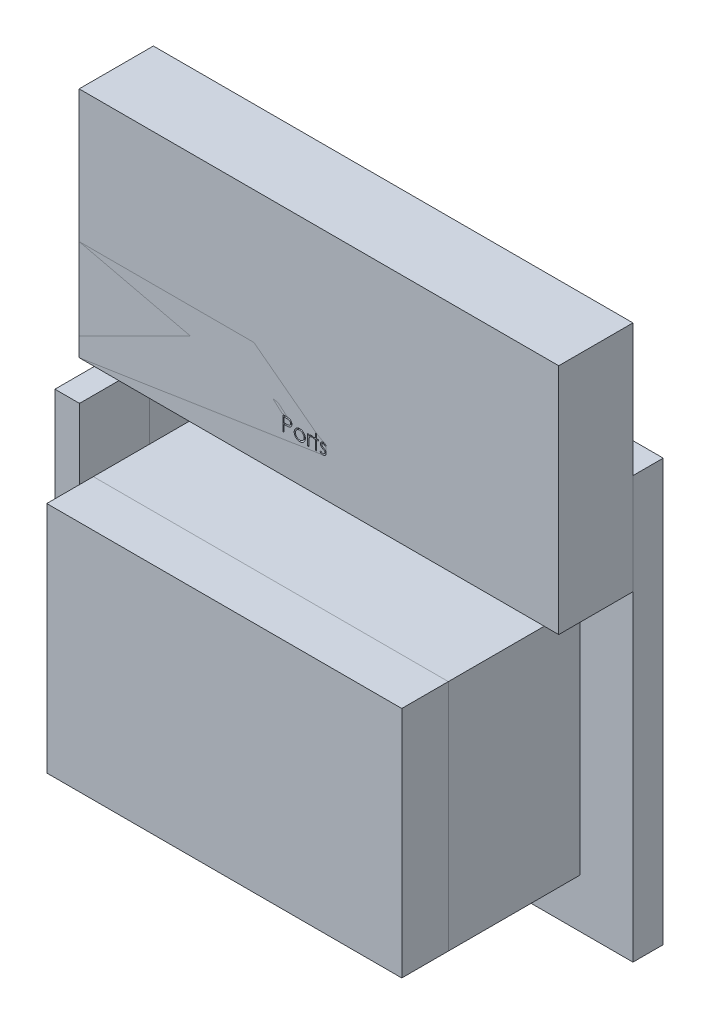
from build123d import *

# Parameters (mm, degrees)
SKETCH1_W           = 103
SKETCH1_H           = 90.5
BOSS_EXTRUDE1_DEPTH = 6.5
SKETCH2_W           = 76.24
SKETCH2_H           = 50.13
BOSS_EXTRUDE2_DEPTH = 28.27
SKETCH2_4_W         = 5.28
SKETCH2_4_H         = 51
BOSS_EXTRUDE3_DEPTH = 9
SKETCH2_5_W         = 103
SKETCH2_5_H         = 21.6
BOSS_EXTRUDE4_DEPTH = 15.94
SKETCH9_W           = 76.24
SKETCH9_H           = 50.13
BOSS_EXTRUDE5_DEPTH = 10
SKETCH10_W          = 103
SKETCH10_H          = 15.94
BOSS_EXTRUDE6_DEPTH = 50
CUT_EXTRUDE1_DEPTH  = 1
SKETCH8_W           = 0.284935898
SKETCH8_H           = 2.320192307
CUT_EXTRUDE2_DEPTH  = 1
SKETCH7_W           = 2.320192307
SKETCH7_H           = 0.284935897
CUT_EXTRUDE3_DEPTH  = 1
SKETCH11_W          = 5.28
SKETCH11_H          = 51
BOSS_EXTRUDE7_DEPTH = 15


with BuildPart() as part:
    # Sketch1 → Boss-Extrude1 (new body)
    with BuildSketch(Plane.XY):
        with Locations((51.5, 45.25)):
            Rectangle(SKETCH1_W, SKETCH1_H)
    extrude(amount=-BOSS_EXTRUDE1_DEPTH)

    # Sketch2 → Boss-Extrude2 (add)
    with BuildSketch(Plane.XY):
        with Locations((53.5, 35.565)):
            Rectangle(SKETCH2_W, SKETCH2_H)
    extrude(amount=BOSS_EXTRUDE2_DEPTH)

    # Sketch2<4> → Boss-Extrude3 (add)
    with BuildSketch(Plane.XY):
        with Locations((5.5, 43)):
            Rectangle(SKETCH2_4_W, SKETCH2_4_H)
    extrude(amount=BOSS_EXTRUDE3_DEPTH)

    # Sketch2<5> → Boss-Extrude4 (add)
    with BuildSketch(Plane.XY):
        with Locations((51.5, 79.7)):
            Rectangle(SKETCH2_5_W, SKETCH2_5_H)
    extrude(amount=BOSS_EXTRUDE4_DEPTH)


with BuildPart() as body_2:
    # Sketch9 → Boss-Extrude5 (new body)
    with BuildSketch(Plane.XY.offset(28.27)):
        with Locations((53.5, 35.565)):
            Rectangle(SKETCH9_W, SKETCH9_H)
    extrude(amount=BOSS_EXTRUDE5_DEPTH)


with BuildPart() as body_3:
    # Sketch10 → Boss-Extrude6 (new body)
    with BuildSketch(Plane.XZ.offset(-68.9)):
        with Locations((51.5, 7.97)):
            Rectangle(SKETCH10_W, SKETCH10_H)
    extrude(amount=-BOSS_EXTRUDE6_DEPTH)


with BuildPart() as cut_extrude1_tool:
    # Sketch6 → Cut-Extrude1 (new body)
    # profile 1 of 5: a face of its own
    with BuildSketch(Plane.XY.offset(15.94)):
        with BuildLine():
            Line((43.74356414, 80.197996717), (44.366225398, 80.197996717))
            add(Edge.make_bspline(
                [(44.366225398, 80.197996717), (44.409052435, 80.197949639), (44.491110938, 80.197859437), (44.608781024, 80.195124632), (44.715651281, 80.191471847), (44.811491269, 80.186408273), (44.896595873, 80.180424223), (44.970579994, 80.172031301), (45.034025163, 80.163268033), (45.0720403, 80.154358615), (45.089377442, 80.150295395)],
                knots=[0, 0, 0, 0, 1.415646017, 2.712440637, 3.8905458, 4.950247383, 5.884950622, 6.709939814, 7.411656543, 8, 8, 8, 8], degree=3))
            add(Edge.make_bspline(
                [(45.089377442, 80.150295395), (45.111324433, 80.14428834), (45.154701262, 80.13241578), (45.217204351, 80.108636188), (45.276671054, 80.080440224), (45.333305396, 80.04830565), (45.386411429, 80.010853745), (45.43678148, 79.969602678), (45.483971034, 79.92360004), (45.527714725, 79.873361798), (45.567887363, 79.819731322), (45.602476432, 79.761908013), (45.631438988, 79.700865188), (45.656279527, 79.636645305), (45.674157911, 79.568709083), (45.68762617, 79.497528566), (45.696174747, 79.423111383), (45.696993499, 79.372257074), (45.697410294, 79.346369113)],
                knots=[0, 0, 0, 0, 0.999701418, 1.975846123, 2.934577507, 3.890451536, 4.834027766, 5.787354733, 6.749476667, 7.726910423, 8.712836071, 9.690891519, 10.682875813, 11.679750201, 12.712814741, 13.765529915, 14.8625177, 16, 16, 16, 16], degree=3))
            add(Edge.make_bspline(
                [(45.697410294, 79.346369113), (45.697028002, 79.320263558), (45.696280021, 79.269186277), (45.687302676, 79.194462391), (45.675210288, 79.123053565), (45.656616534, 79.055118135), (45.632263673, 78.991059543), (45.603695882, 78.929898854), (45.569239394, 78.872676581), (45.529647298, 78.819184981), (45.485604066, 78.769373846), (45.437296044, 78.72360414), (45.384918257, 78.682143776), (45.328637166, 78.644899807), (45.267904089, 78.612735896), (45.203640135, 78.583927484), (45.135286724, 78.559733022), (45.087986015, 78.547005752), (45.063936737, 78.540534778)],
                knots=[0, 0, 0, 0, 1.121902311, 2.195077645, 3.232258892, 4.234102512, 5.217864754, 6.176164875, 7.132989551, 8.084763148, 9.034132444, 9.988522005, 10.94243251, 11.903244335, 12.886203696, 13.894208494, 14.929344452, 16, 16, 16, 16], degree=3))
            add(Edge.make_bspline(
                [(45.063936737, 78.540534778), (45.044045512, 78.536304788), (45.000452737, 78.527034519), (44.928658982, 78.516685419), (44.845069954, 78.507852024), (44.749799742, 78.501228849), (44.642933864, 78.495558872), (44.52441451, 78.491052101), (44.394009025, 78.488575733), (44.303048682, 78.488448014), (44.255558331, 78.488381332)],
                knots=[0, 0, 0, 0, 0.601384939, 1.31797006, 2.144135048, 3.087295005, 4.142315834, 5.309527816, 6.595305764, 8, 8, 8, 8], degree=3))
            Line((44.255558331, 78.488381332), (44.028500038, 78.488381332))
            Line((44.028500038, 78.488381332), (44.028500038, 77.022996717))
            Line((44.028500038, 77.022996717), (43.74356414, 77.022996717))
            Line((43.74356414, 77.022996717), (43.74356414, 80.197996717))
        make_face()
        with BuildLine():
            Line((44.028500038, 79.872355691), (44.028500038, 78.814022358))
            Line((44.028500038, 78.814022358), (44.584379445, 78.807026164))
            add(Edge.make_bspline(
                [(44.584379445, 78.807026164), (44.611521092, 78.807012136), (44.663917482, 78.806985056), (44.739606056, 78.810600223), (44.809827338, 78.814773563), (44.874365631, 78.820884008), (44.933250029, 78.829521149), (44.986578716, 78.838240368), (45.03393818, 78.850854519), (45.089363884, 78.867839017), (45.151125206, 78.896806461), (45.218315054, 78.938852433), (45.275256943, 78.992447075), (45.324531398, 79.052706608), (45.363634587, 79.119743676), (45.39226038, 79.191470497), (45.409079859, 79.267151475), (45.411335192, 79.318938572), (45.412474397, 79.345097077)],
                knots=[0, 0, 0, 0, 1.160613943, 2.240541288, 3.23993089, 4.169200891, 5.011653406, 5.7853311, 6.478053781, 7.106038997, 8.262395093, 9.384106736, 10.481365981, 11.59014053, 12.70357646, 13.786202915, 14.881775077, 16, 16, 16, 16], degree=3))
            add(Edge.make_bspline(
                [(45.412474397, 79.345097077), (45.411328996, 79.370622729), (45.409052081, 79.421364565), (45.392128548, 79.495731012), (45.363690242, 79.566701972), (45.324268903, 79.632898985), (45.276425163, 79.692941686), (45.220817902, 79.745099794), (45.157578015, 79.787029482), (45.098751405, 79.81409253), (45.046498901, 79.830616387), (45.001112766, 79.842177778), (44.949867654, 79.851408507), (44.892746883, 79.858882913), (44.830193183, 79.86528141), (44.761669141, 79.869622975), (44.687434336, 79.872164296), (44.635899032, 79.872290348), (44.609184132, 79.872355691)],
                knots=[0, 0, 0, 0, 1.120700087, 2.227813068, 3.331159281, 4.466773991, 5.599788987, 6.693661531, 7.80175334, 8.91857717, 9.525282508, 10.207424825, 10.974604443, 11.810962634, 12.737642355, 13.736264703, 14.826523623, 16, 16, 16, 16], degree=3))
            Line((44.609184132, 79.872355691), (44.028500038, 79.872355691))
        make_face(mode=Mode.SUBTRACT)
    # profile 2 of 5: a face of its own
    with BuildSketch(Plane.XY.offset(15.94)):
        with BuildLine():
            add(Edge.make_bspline(
                [(47.38794515, 79.383894153), (47.43148009, 79.382967151), (47.516841469, 79.381149528), (47.641852908, 79.361723095), (47.761183139, 79.332016558), (47.875289185, 79.290948783), (47.982709681, 79.235901585), (48.08500931, 79.170216014), (48.181907596, 79.092398947), (48.23998563, 79.032202699), (48.269465583, 79.001647558)],
                knots=[0, 0, 0, 0, 1.054011418, 2.066658804, 3.057071809, 4.030435133, 4.997543892, 5.974964718, 6.972108034, 8, 8, 8, 8], degree=3))
            add(Edge.make_bspline(
                [(48.269465583, 79.001647558), (48.294849212, 78.972424871), (48.345125229, 78.914545036), (48.409591988, 78.820696016), (48.465128689, 78.723504639), (48.509635804, 78.621680278), (48.544728647, 78.516111827), (48.569643957, 78.406436431), (48.584463891, 78.292896302), (48.586462296, 78.215785677), (48.587474397, 78.176732694)],
                knots=[0, 0, 0, 0, 1.025258237, 2.030674902, 3.01204498, 3.988269485, 4.97094183, 5.956517959, 6.965070386, 8, 8, 8, 8], degree=3))
            add(Edge.make_bspline(
                [(48.587474397, 78.176732694), (48.586584184, 78.137453356), (48.584825081, 78.059835552), (48.5681848, 77.945517985), (48.54230303, 77.834669824), (48.505262719, 77.727755152), (48.457766434, 77.624447159), (48.399808454, 77.525197068), (48.330982058, 77.429809061), (48.252964147, 77.339093108), (48.166738516, 77.255485184), (48.073197439, 77.182615968), (47.974179137, 77.120185014), (47.868366952, 77.069896266), (47.75672716, 77.030245323), (47.639018963, 77.002396023), (47.515425221, 76.985557924), (47.431036241, 76.983395682), (47.38794515, 76.982291589)],
                knots=[0, 0, 0, 0, 0.998656419, 1.973391657, 2.932242238, 3.890759089, 4.846373663, 5.82037756, 6.809684879, 7.83454468, 8.860553229, 9.859544525, 10.845671541, 11.83227036, 12.833544569, 13.85385346, 14.904124723, 16, 16, 16, 16], degree=3))
            add(Edge.make_bspline(
                [(47.38794515, 76.982291589), (47.34464294, 76.983399388), (47.259833375, 76.985569069), (47.135803377, 77.002330604), (47.017884222, 77.030232488), (46.906098279, 77.070026571), (46.799831168, 77.120186621), (46.700239132, 77.182427226), (46.606622066, 77.255506795), (46.520378194, 77.339087252), (46.442365173, 77.42981057), (46.373537516, 77.525196676), (46.315579863, 77.624447261), (46.268083492, 77.727755125), (46.231043205, 77.834669832), (46.205161428, 77.945517983), (46.188521149, 78.059835553), (46.186762046, 78.137453356), (46.185871833, 78.176732694)],
                knots=[0, 0, 0, 0, 1.099876186, 2.154163076, 3.173186993, 4.173200201, 5.163417411, 6.152872554, 7.150605724, 8.17532212, 9.198891216, 10.186952605, 11.159729845, 12.11414092, 13.071450619, 14.029093627, 15.002601286, 16, 16, 16, 16], degree=3))
            add(Edge.make_bspline(
                [(46.185871833, 78.176732694), (46.186890836, 78.215573418), (46.188908286, 78.292471376), (46.20371332, 78.405798067), (46.228531439, 78.515287841), (46.263666348, 78.620448809), (46.3085837, 78.721826954), (46.363340011, 78.819258479), (46.428464371, 78.912683127), (46.478540427, 78.970488157), (46.503880647, 78.999739505)],
                knots=[0, 0, 0, 0, 1.031353054, 2.041901799, 3.029428768, 4.008703097, 4.981709435, 5.96992636, 6.972712378, 8, 8, 8, 8], degree=3))
            add(Edge.make_bspline(
                [(46.503880647, 78.999739505), (46.533316154, 79.030559629), (46.591206259, 79.091172824), (46.688586891, 79.168763043), (46.790634857, 79.235815481), (46.899242469, 79.289768905), (47.013254776, 79.332258132), (47.133196517, 79.361799706), (47.258632163, 79.381079536), (47.344411248, 79.382946597), (47.38794515, 79.383894153)],
                knots=[0, 0, 0, 0, 1.027980169, 2.021703884, 2.998553061, 3.971491411, 4.943284454, 5.930300938, 6.949603206, 8, 8, 8, 8], degree=3))
        make_face()
        with BuildLine():
            add(Edge.make_bspline(
                [(47.386673115, 79.098958255), (47.355886853, 79.098083233), (47.295109072, 79.096355776), (47.20564702, 79.083216806), (47.119522738, 79.062400141), (47.036572829, 79.032823605), (46.957077023, 78.994633889), (46.880959208, 78.947727019), (46.807995494, 78.892724266), (46.739613194, 78.8297117), (46.676854954, 78.760878612), (46.621992789, 78.687537601), (46.575342871, 78.610878272), (46.536480727, 78.530820909), (46.507536349, 78.446554219), (46.486515108, 78.359032504), (46.473388532, 78.268077448), (46.471677317, 78.206245667), (46.47080773, 78.174824641)],
                knots=[0, 0, 0, 0, 1.021534396, 2.016698045, 2.994645724, 3.958388632, 4.93408049, 5.916473867, 6.921342795, 7.962252576, 8.998418191, 10.008913653, 10.997312074, 11.973003931, 12.956656626, 13.948281152, 14.957379055, 16, 16, 16, 16], degree=3))
            add(Edge.make_bspline(
                [(46.47080773, 78.174824641), (46.472265349, 78.13422816), (46.475158449, 78.053651735), (46.498685414, 77.934987359), (46.538042967, 77.821066679), (46.59119, 77.712557529), (46.657779927, 77.612161962), (46.736236051, 77.52265283), (46.825716351, 77.44537713), (46.925154176, 77.381259505), (47.03251845, 77.330314584), (47.146143827, 77.294211228), (47.2646536, 77.270741907), (47.345643977, 77.268409212), (47.386673115, 77.267227486)],
                knots=[0, 0, 0, 0, 1.016792936, 2.018143844, 3.017858371, 4.030088057, 5.03801393, 6.028138512, 7.003788237, 7.991172063, 8.984598303, 9.972568034, 10.972917682, 12, 12, 12, 12], degree=3))
            add(Edge.make_bspline(
                [(47.386673115, 77.267227486), (47.427699892, 77.268416097), (47.508685612, 77.270762383), (47.627030722, 77.294093027), (47.740345539, 77.330472776), (47.847598298, 77.381202209), (47.94699086, 77.445620614), (48.037114705, 77.522216471), (48.114900946, 77.612399036), (48.181425001, 77.712690508), (48.235442404, 77.820898456), (48.274615737, 77.935008385), (48.298199261, 78.05364638), (48.301084727, 78.134226366), (48.302538499, 78.174824641)],
                knots=[0, 0, 0, 0, 1.02726834, 2.027799167, 3.010890988, 4.004497153, 4.992059811, 5.971914811, 6.958719428, 7.966827853, 8.981595046, 9.981490638, 10.983022906, 12, 12, 12, 12], degree=3))
            add(Edge.make_bspline(
                [(48.302538499, 78.174824641), (48.301669212, 78.206245854), (48.299958586, 78.268078005), (48.286827725, 78.359030373), (48.265822343, 78.446562036), (48.236819519, 78.530792068), (48.198126235, 78.611085554), (48.150576715, 78.68731252), (48.095938571, 78.761132673), (48.03242304, 78.82948919), (47.964112118, 78.89274883), (47.891118834, 78.947748348), (47.815113889, 78.994427738), (47.735849032, 79.033150256), (47.652888488, 79.062131058), (47.566884878, 79.083337002), (47.477804529, 79.096300252), (47.41724454, 79.098066587), (47.386673115, 79.098958255)],
                knots=[0, 0, 0, 0, 1.042956736, 2.052379634, 3.044323526, 4.02829302, 5.004299113, 5.996692471, 7.007513377, 8.048758398, 9.090003419, 10.095195979, 11.07790575, 12.047570684, 13.018257071, 13.989683339, 14.985167495, 16, 16, 16, 16], degree=3))
        make_face(mode=Mode.SUBTRACT)
    # profile 3 of 5: a face of its own
    with BuildSketch(Plane.XY.offset(15.94)):
        with BuildLine():
            Line((49.075935935, 79.343189024), (49.360871833, 79.343189024))
            Line((49.360871833, 79.343189024), (49.360871833, 79.001647558))
            add(Edge.make_bspline(
                [(49.360871833, 79.001647558), (49.38190735, 79.033448202), (49.422137612, 79.094266687), (49.48900577, 79.17470241), (49.557498077, 79.241300346), (49.627942426, 79.294371395), (49.700856845, 79.334116153), (49.77464108, 79.36322912), (49.85045597, 79.380444256), (49.901402859, 79.382742647), (49.926927522, 79.383894153)],
                knots=[0, 0, 0, 0, 1.2804753, 2.448899062, 3.506932113, 4.484331642, 5.4025378, 6.288909075, 7.142734305, 8, 8, 8, 8], degree=3))
            add(Edge.make_bspline(
                [(49.926927522, 79.383894153), (49.946727118, 79.382814175), (49.987466074, 79.380592051), (50.049135995, 79.364979374), (50.112675412, 79.340052882), (50.153626006, 79.316612109), (50.174974397, 79.304391949)],
                knots=[0, 0, 0, 0, 0.901110191, 1.854092781, 2.881294221, 4, 4, 4, 4], degree=3))
            Line((50.174974397, 79.304391949), (50.01851406, 79.057617109))
            add(Edge.make_bspline(
                [(50.01851406, 79.057617109), (50.00480802, 79.063731494), (49.978791331, 79.075337765), (49.940732546, 79.089073732), (49.905643047, 79.097161741), (49.883287819, 79.098387035), (49.872866023, 79.098958255)],
                knots=[0, 0, 0, 0, 1.180555205, 2.24091978, 3.179933427, 4, 4, 4, 4], degree=3))
            add(Edge.make_bspline(
                [(49.872866023, 79.098958255), (49.850000822, 79.097434221), (49.80336244, 79.094325634), (49.734887216, 79.069888287), (49.668441536, 79.030404676), (49.615671528, 78.986615882), (49.57481177, 78.94439038), (49.545655994, 78.907516472), (49.518910931, 78.866170142), (49.493356517, 78.821058214), (49.470073521, 78.771410425), (49.448343214, 78.717722796), (49.428695531, 78.659933144), (49.417492096, 78.619671857), (49.411753243, 78.599048399)],
                knots=[0, 0, 0, 0, 1.125678352, 2.296057538, 3.5422874, 4.923748041, 5.663163013, 6.437101912, 7.23742474, 8.08941207, 8.991984279, 9.93940061, 10.944477711, 12, 12, 12, 12], degree=3))
            add(Edge.make_bspline(
                [(49.411753243, 78.599048399), (49.407460286, 78.580654106), (49.397951713, 78.539912145), (49.388706532, 78.471560269), (49.379572041, 78.390803092), (49.373134394, 78.297415826), (49.36716717, 78.19163168), (49.363801596, 78.073289501), (49.360986604, 77.942267818), (49.36091125, 77.850669655), (49.360871833, 77.802754329)],
                knots=[0, 0, 0, 0, 0.566838948, 1.255505196, 2.06880316, 3.007127437, 4.065329342, 5.249902469, 6.561414163, 8, 8, 8, 8], degree=3))
            Line((49.360871833, 77.802754329), (49.360871833, 77.022996717))
            Line((49.360871833, 77.022996717), (49.075935935, 77.022996717))
            Line((49.075935935, 77.022996717), (49.075935935, 79.343189024))
        make_face()
    # profile 4 of 5: a face of its own
    with BuildSketch(Plane.XY.offset(15.94)):
        Polygon((50.744846192, 80.279406973), (51.029782089, 80.279406973), (51.029782089, 79.343189024), (51.436833371, 79.343189024), (51.436833371, 79.058253127), (51.029782089, 79.058253127), (51.029782089, 77.022996717), (50.744846192, 77.022996717), (50.744846192, 79.058253127), (50.33779491, 79.058253127), (50.33779491, 79.343189024), (50.744846192, 79.343189024), align=None)
    # profile 5 of 5: a face of its own
    with BuildSketch(Plane.XY.offset(15.94)):
        with BuildLine():
            Line((53.024333371, 79.053801004), (52.830984012, 78.854727486))
            add(Edge.make_bspline(
                [(52.830984012, 78.854727486), (52.814301198, 78.874061554), (52.782138697, 78.911335362), (52.731128711, 78.96117113), (52.680307299, 79.003023924), (52.630370161, 79.038359188), (52.580061588, 79.065073771), (52.529971955, 79.084572681), (52.4800494, 79.096639319), (52.446679211, 79.09819456), (52.430292906, 79.098958255)],
                knots=[0, 0, 0, 0, 1.26578478, 2.440284043, 3.530471711, 4.527705817, 5.468200915, 6.346673037, 7.188140097, 8, 8, 8, 8], degree=3))
            add(Edge.make_bspline(
                [(52.430292906, 79.098958255), (52.410209317, 79.097983192), (52.370687656, 79.096064405), (52.31405852, 79.076911508), (52.261489025, 79.047512152), (52.215989479, 79.00581208), (52.177447083, 78.95794735), (52.149313244, 78.904429256), (52.132108387, 78.846872816), (52.129926952, 78.806931445), (52.128820551, 78.7866736)],
                knots=[0, 0, 0, 0, 0.99966794, 1.967205029, 2.953328237, 3.988086729, 5.028030931, 6.008226631, 6.989793394, 8, 8, 8, 8], degree=3))
            add(Edge.make_bspline(
                [(52.128820551, 78.7866736), (52.129828216, 78.768338388), (52.131840706, 78.731719652), (52.147485908, 78.677701078), (52.172401559, 78.625035051), (52.195688093, 78.592774414), (52.207686737, 78.576151765)],
                knots=[0, 0, 0, 0, 0.960159726, 1.917612774, 2.927026955, 4, 4, 4, 4], degree=3))
            add(Edge.make_bspline(
                [(52.207686737, 78.576151765), (52.214910763, 78.567275749), (52.230286193, 78.548384268), (52.25914106, 78.522164344), (52.291818616, 78.493188159), (52.331115988, 78.464216886), (52.375340135, 78.433708106), (52.425450057, 78.402863314), (52.479855501, 78.3693313), (52.518805772, 78.348063848), (52.539051921, 78.337009137)],
                knots=[0, 0, 0, 0, 0.66740084, 1.420478572, 2.27185888, 3.217733974, 4.268547843, 5.408967954, 6.65319498, 8, 8, 8, 8], degree=3))
            add(Edge.make_bspline(
                [(52.539051921, 78.337009137), (52.563738523, 78.323179832), (52.611424909, 78.296466169), (52.67918192, 78.255000938), (52.74067445, 78.213788146), (52.79642352, 78.173268547), (52.845356446, 78.132308446), (52.888957862, 78.092477838), (52.926140236, 78.052573251), (52.946962727, 78.024693927), (52.956915503, 78.011368111)],
                knots=[0, 0, 0, 0, 1.27191281, 2.456916733, 3.569705269, 4.599008579, 5.553216877, 6.436649441, 7.252746552, 8, 8, 8, 8], degree=3))
            add(Edge.make_bspline(
                [(52.956915503, 78.011368111), (52.973435052, 77.984456731), (53.006312023, 77.93089809), (53.040836307, 77.842707088), (53.060848128, 77.749171133), (53.063625999, 77.685188333), (53.065038499, 77.652654169)],
                knots=[0, 0, 0, 0, 0.995354457, 1.980940102, 2.973342416, 4, 4, 4, 4], degree=3))
            add(Edge.make_bspline(
                [(53.065038499, 77.652654169), (53.064385779, 77.629731443), (53.063099523, 77.584559708), (53.054156848, 77.518034541), (53.038776263, 77.454412479), (53.017826929, 77.393003185), (52.989538248, 77.334983289), (52.956384175, 77.278888978), (52.916583362, 77.225933669), (52.871143328, 77.176186898), (52.82139063, 77.13075197), (52.768317205, 77.090815955), (52.711857694, 77.057637806), (52.652415524, 77.030182814), (52.589855638, 77.008349466), (52.524168254, 76.99323417), (52.45556217, 76.984187451), (52.408907986, 76.982931533), (52.385135655, 76.982291589)],
                knots=[0, 0, 0, 0, 1.032770009, 2.035186124, 3.017557409, 3.978232242, 4.952395191, 5.920591857, 6.910227898, 7.931268572, 8.952309245, 9.941945286, 10.918353717, 11.897095711, 12.887975737, 13.898235213, 14.929059601, 16, 16, 16, 16], degree=3))
            add(Edge.make_bspline(
                [(52.385135655, 76.982291589), (52.353052574, 76.98319211), (52.289332205, 76.984980639), (52.195089388, 77.00176828), (52.102995557, 77.027889816), (52.013747631, 77.063917842), (51.929341514, 77.109411703), (51.852115603, 77.163896874), (51.781801634, 77.225573515), (51.741780057, 77.272847369), (51.721769269, 77.296484297)],
                knots=[0, 0, 0, 0, 1.013940152, 2.01379169, 3.017749504, 4.037548394, 5.051665909, 6.043208538, 7.021604269, 8, 8, 8, 8], degree=3))
            Line((51.721769269, 77.296484297), (51.910666504, 77.511458255))
            add(Edge.make_bspline(
                [(51.910666504, 77.511458255), (51.928602907, 77.492086433), (51.963375337, 77.454531227), (52.018984298, 77.404525575), (52.075571326, 77.362614422), (52.132571363, 77.327559324), (52.190828163, 77.30054878), (52.250015256, 77.281572627), (52.310012255, 77.269376824), (52.350309478, 77.267945096), (52.370507249, 77.267227486)],
                knots=[0, 0, 0, 0, 1.179806542, 2.287233372, 3.337373186, 4.324005949, 5.273901747, 6.200048787, 7.097828587, 8, 8, 8, 8], degree=3))
            add(Edge.make_bspline(
                [(52.370507249, 77.267227486), (52.398009939, 77.26847102), (52.451745582, 77.270900677), (52.528710992, 77.292959753), (52.599775317, 77.327549067), (52.661482209, 77.376611614), (52.714007741, 77.433721312), (52.752042585, 77.498050549), (52.77587883, 77.56771137), (52.778678271, 77.616000673), (52.780102602, 77.640569834)],
                knots=[0, 0, 0, 0, 1.072336372, 2.095165389, 3.102688358, 4.141489647, 5.156069229, 6.117746104, 7.042326257, 8, 8, 8, 8], degree=3))
            add(Edge.make_bspline(
                [(52.780102602, 77.640569834), (52.779117178, 77.660807845), (52.77717159, 77.700765089), (52.761892336, 77.758595755), (52.737750677, 77.813450032), (52.713979317, 77.845553497), (52.701872434, 77.861903968)],
                knots=[0, 0, 0, 0, 1.013901739, 2.00181326, 2.98231254, 4, 4, 4, 4], degree=3))
            add(Edge.make_bspline(
                [(52.701872434, 77.861903968), (52.694594976, 77.870100333), (52.678742044, 77.887954974), (52.649663361, 77.913740581), (52.614845529, 77.941533714), (52.573896953, 77.970863084), (52.526735084, 78.001341819), (52.473168774, 78.032810017), (52.413931844, 78.066762311), (52.372048486, 78.089277284), (52.350154685, 78.101046597)],
                knots=[0, 0, 0, 0, 0.615000592, 1.339693406, 2.178160186, 3.116406724, 4.166410947, 5.330106347, 6.604359322, 8, 8, 8, 8], degree=3))
            add(Edge.make_bspline(
                [(52.350154685, 78.101046597), (52.326526662, 78.114235666), (52.280704384, 78.139813481), (52.21580077, 78.179651639), (52.157247098, 78.220171238), (52.103634434, 78.259099314), (52.056316951, 78.298488313), (52.015481055, 78.338381963), (51.979518995, 78.377171379), (51.959609557, 78.404655355), (51.950099597, 78.417783375)],
                knots=[0, 0, 0, 0, 1.262093308, 2.447601706, 3.550203992, 4.582594899, 5.537233252, 6.418365656, 7.244515135, 8, 8, 8, 8], degree=3))
            add(Edge.make_bspline(
                [(51.950099597, 78.417783375), (51.933652553, 78.444222612), (51.900752718, 78.497110324), (51.868807509, 78.585384828), (51.846849182, 78.67831713), (51.844887586, 78.742440205), (51.843884653, 78.775225282)],
                knots=[0, 0, 0, 0, 0.985009483, 1.970363186, 2.962279964, 4, 4, 4, 4], degree=3))
            add(Edge.make_bspline(
                [(51.843884653, 78.775225282), (51.844369245, 78.796656893), (51.845317659, 78.838601593), (51.852886906, 78.900231808), (51.866667958, 78.958786205), (51.883953495, 79.015144145), (51.907977363, 79.068213902), (51.93668472, 79.118703179), (51.970419027, 79.16654219), (52.009284012, 79.210995031), (52.052016469, 79.251371349), (52.098185296, 79.286567247), (52.146752143, 79.31659944), (52.197922638, 79.341786407), (52.252188352, 79.360837662), (52.309169974, 79.373952575), (52.368752165, 79.382711224), (52.409483901, 79.383494164), (52.430292906, 79.383894153)],
                knots=[0, 0, 0, 0, 1.087655834, 2.128696564, 3.144119009, 4.137814668, 5.115653402, 6.093965665, 7.082169637, 8.081268856, 9.086088321, 10.061021666, 11.022561449, 11.980240094, 12.950172527, 13.934149372, 14.944599409, 16, 16, 16, 16], degree=3))
            add(Edge.make_bspline(
                [(52.430292906, 79.383894153), (52.454959993, 79.382892358), (52.504756894, 79.380869976), (52.579464305, 79.364808385), (52.654061693, 79.338380498), (52.728740732, 79.301880486), (52.802954352, 79.254648391), (52.877355358, 79.197562527), (52.952836928, 79.130998457), (52.999968726, 79.080108446), (53.024333371, 79.053801004)],
                knots=[0, 0, 0, 0, 0.845714091, 1.707292901, 2.609013841, 3.555613372, 4.552488639, 5.621697636, 6.770543573, 8, 8, 8, 8], degree=3))
        make_face()
    extrude(amount=-CUT_EXTRUDE1_DEPTH)


with BuildPart() as part_1:
    add(part.part)

    # Cut-Extrude1: cut by cut_extrude1_tool
    add(cut_extrude1_tool.part, mode=Mode.SUBTRACT)

    # Sketch8 → Cut-Extrude2 (cut)
    # profile 1 of 5: a face of its own
    with BuildSketch(Plane.XY.offset(28.27)):
        with BuildLine():
            Line((48.847347934, 40.090031574), (48.598029024, 39.899226286))
            add(Edge.make_bspline(
                [(48.598029024, 39.899226286), (48.580243682, 39.920422558), (48.544912784, 39.962529332), (48.488071936, 40.02165649), (48.428834017, 40.077051406), (48.367221671, 40.128977968), (48.302125899, 40.17562032), (48.235123603, 40.219409106), (48.165093948, 40.258659125), (48.068254874, 40.306250549), (47.941574326, 40.355913132), (47.782103293, 40.39755392), (47.615632511, 40.424061701), (47.502060403, 40.426932665), (47.444293046, 40.428392952)],
                knots=[0, 0, 0, 0, 0.757959112, 1.505699292, 2.245454638, 2.979532153, 3.711538275, 4.438200793, 5.171680507, 5.909471876, 7.393775596, 8.890124382, 10.418191784, 12, 12, 12, 12], degree=3))
            add(Edge.make_bspline(
                [(47.444293046, 40.428392952), (47.412467482, 40.428026501), (47.349111724, 40.427296998), (47.255087752, 40.417673006), (47.162819484, 40.404146408), (47.07236694, 40.38407558), (46.983845256, 40.358700418), (46.89667572, 40.328378792), (46.81212039, 40.290864045), (46.72900956, 40.249400123), (46.649381275, 40.202566656), (46.574038482, 40.151482401), (46.503255968, 40.096719006), (46.436977741, 40.038071217), (46.375136046, 39.975803153), (46.318178985, 39.909251214), (46.266303649, 39.838628171), (46.218481776, 39.764865294), (46.175653082, 39.68817744), (46.139793834, 39.608280769), (46.108039188, 39.526543476), (46.082912018, 39.442042066), (46.063023349, 39.355371128), (46.049300397, 39.266298056), (46.039785855, 39.175008932), (46.039059981, 39.113133342), (46.038694088, 39.081943633)],
                knots=[0, 0, 0, 0, 1.054917814, 2.100044995, 3.131103042, 4.146048494, 5.169673617, 6.183595914, 7.203665975, 8.234915748, 9.262203917, 10.264457458, 11.251630812, 12.227803204, 13.197192746, 14.159520551, 15.12972552, 16.100847026, 17.073214652, 18.039054194, 19.002613845, 19.979014051, 20.95965708, 21.949030935, 22.966165397, 24, 24, 24, 24], degree=3))
            add(Edge.make_bspline(
                [(46.038694088, 39.081943633), (46.039838738, 39.035015936), (46.042086107, 38.942879627), (46.062087095, 38.80792343), (46.092481, 38.678636819), (46.138033702, 38.555827962), (46.194203126, 38.437982523), (46.265178538, 38.32709442), (46.347380683, 38.221487965), (46.441972477, 38.123659006), (46.545754896, 38.034292983), (46.657104787, 37.955597813), (46.77574482, 37.889997884), (46.900365049, 37.835409704), (47.031924452, 37.793448244), (47.170186451, 37.763907932), (47.314850333, 37.744638239), (47.413701146, 37.742793394), (47.464009593, 37.741854491)],
                knots=[0, 0, 0, 0, 1.029171465, 2.020641659, 2.987623507, 3.938342917, 4.889210282, 5.84687017, 6.821220943, 7.821438502, 8.827599549, 9.822697543, 10.807740252, 11.797342354, 12.80366471, 13.83203677, 14.896651826, 16, 16, 16, 16], degree=3))
            add(Edge.make_bspline(
                [(47.464009593, 37.741854491), (47.519438461, 37.743386455), (47.628535732, 37.746401728), (47.788526728, 37.77194619), (47.941684886, 37.813364444), (48.088018447, 37.871328987), (48.227114876, 37.94668107), (48.359191847, 38.03802843), (48.484360843, 38.146239989), (48.559627649, 38.228865399), (48.598029024, 38.271021158)],
                knots=[0, 0, 0, 0, 1.028121516, 2.023589091, 2.998037872, 3.967518031, 4.937445131, 5.927275754, 6.942489185, 8, 8, 8, 8], degree=3))
            Line((48.598029024, 38.271021158), (48.847347934, 38.082123922))
            add(Edge.make_bspline(
                [(48.847347934, 38.082123922), (48.827283649, 38.056235469), (48.787251185, 38.004582568), (48.722428555, 37.93176466), (48.654141292, 37.863271713), (48.581882184, 37.799655942), (48.506482473, 37.739644391), (48.426588304, 37.684942016), (48.343249967, 37.634785285), (48.256749833, 37.588859432), (48.167179806, 37.548113072), (48.074647211, 37.513230012), (47.979550903, 37.483181005), (47.881886535, 37.458459605), (47.781451527, 37.439163693), (47.678608311, 37.426264417), (47.573134924, 37.417427109), (47.501977349, 37.416621642), (47.465917646, 37.416213465)],
                knots=[0, 0, 0, 0, 0.986787822, 1.968848986, 2.935600012, 3.899624008, 4.868462664, 5.837806735, 6.815139263, 7.798259679, 8.787526145, 9.778297419, 10.776456485, 11.791383307, 12.812564526, 13.85620153, 14.913611965, 16, 16, 16, 16], degree=3))
            add(Edge.make_bspline(
                [(47.465917646, 37.416213465), (47.431769462, 37.41645113), (47.364245657, 37.416921082), (47.26455179, 37.424533977), (47.167496956, 37.434920524), (47.073358545, 37.450559786), (46.981622839, 37.469015009), (46.893121452, 37.493753934), (46.806983511, 37.521466393), (46.723555088, 37.554037345), (46.642765217, 37.59079131), (46.564874474, 37.632330796), (46.489918682, 37.678306487), (46.417160907, 37.727704961), (46.347675956, 37.782112942), (46.280861687, 37.840774818), (46.216343441, 37.90349287), (46.176426719, 37.948718345), (46.156357349, 37.971456855)],
                knots=[0, 0, 0, 0, 1.114604814, 2.203992996, 3.262667896, 4.300477797, 5.318619304, 6.316056647, 7.298880507, 8.271930387, 9.238335007, 10.195173496, 11.151986948, 12.108099108, 13.064862484, 14.031167946, 15.010108607, 16, 16, 16, 16], degree=3))
            add(Edge.make_bspline(
                [(46.156357349, 37.971456855), (46.124212158, 38.010954933), (46.060309861, 38.089474235), (45.978552991, 38.216733661), (45.908569138, 38.34960125), (45.851985267, 38.488775043), (45.807750502, 38.633942744), (45.777106132, 38.785177532), (45.757192891, 38.942338165), (45.7549157, 39.049232966), (45.75375819, 39.103568233)],
                knots=[0, 0, 0, 0, 0.994628077, 1.977248131, 2.950237994, 3.925870899, 4.908910175, 5.911660606, 6.938484602, 8, 8, 8, 8], degree=3))
            add(Edge.make_bspline(
                [(45.75375819, 39.103568233), (45.755168973, 39.160677823), (45.7579446, 39.273037376), (45.7815265, 39.437932319), (45.819462123, 39.595912517), (45.873343586, 39.746683056), (45.941656297, 39.891036954), (46.026044726, 40.027871475), (46.12552849, 40.158061715), (46.239327355, 40.279632239), (46.364120581, 40.390792938), (46.497759791, 40.488588565), (46.639983414, 40.569975169), (46.789224608, 40.638007402), (46.946600905, 40.690299165), (47.111776533, 40.72690527), (47.28444112, 40.749690083), (47.402244891, 40.75257045), (47.46210154, 40.754033978)],
                knots=[0, 0, 0, 0, 1.032925535, 2.032216505, 3.007276963, 3.968222605, 4.92396291, 5.891752235, 6.871517503, 7.883894988, 8.900124299, 9.891468569, 10.874487609, 11.85992873, 12.854644235, 13.869047385, 14.917252991, 16, 16, 16, 16], degree=3))
            add(Edge.make_bspline(
                [(47.46210154, 40.754033978), (47.498581811, 40.75359661), (47.570790833, 40.752730883), (47.677609311, 40.744288883), (47.781606279, 40.730215826), (47.882853384, 40.711060534), (47.981843186, 40.68728675), (48.077819119, 40.656316622), (48.171344356, 40.620904911), (48.261829051, 40.58012116), (48.348839065, 40.534340616), (48.432347296, 40.484070729), (48.511690418, 40.42937382), (48.587426731, 40.370715082), (48.658289294, 40.306853532), (48.726290064, 40.239545713), (48.789119756, 40.166852886), (48.827903011, 40.115685554), (48.847347934, 40.090031574)],
                knots=[0, 0, 0, 0, 1.096760587, 2.17092713, 3.219439832, 4.250915756, 5.268269357, 6.278326846, 7.281116186, 8.274029601, 9.260640565, 10.235837813, 11.203064059, 12.156899882, 13.114053108, 14.069676657, 15.032185724, 16, 16, 16, 16], degree=3))
        make_face()
    # profile 2 of 5: a face of its own
    with BuildSketch(Plane.XY.offset(28.27)):
        with BuildLine():
            Line((49.417219729, 40.754033978), (49.702155626, 40.754033978))
            Line((49.702155626, 40.754033978), (49.702155626, 39.379599883))
            add(Edge.make_bspline(
                [(49.702155626, 39.379599883), (49.732742036, 39.417830496), (49.792295342, 39.492267457), (49.892531105, 39.589387252), (49.995465396, 39.673568858), (50.104653474, 39.740579916), (50.21809216, 39.793517637), (50.336259894, 39.831062145), (50.459178633, 39.854149925), (50.54265859, 39.857051347), (50.584948094, 39.858521158)],
                knots=[0, 0, 0, 0, 1.125788106, 2.19196713, 3.20547328, 4.180437432, 5.132270164, 6.079753143, 7.027236121, 8, 8, 8, 8], degree=3))
            add(Edge.make_bspline(
                [(50.584948094, 39.858521158), (50.627883522, 39.856937803), (50.711918511, 39.853838796), (50.834275266, 39.8293338), (50.948539774, 39.78746241), (51.05437236, 39.730160895), (51.149463335, 39.658793401), (51.233691336, 39.576396234), (51.302489775, 39.480897751), (51.349297545, 39.392672435), (51.379753422, 39.314169423), (51.399031865, 39.246826301), (51.415377852, 39.171785708), (51.429619755, 39.089086272), (51.439111718, 38.99833101), (51.446735907, 38.899929365), (51.452157405, 38.793886979), (51.452367504, 38.720480753), (51.452476139, 38.682524563)],
                knots=[0, 0, 0, 0, 1.235656852, 2.418478516, 3.575258207, 4.727955599, 5.870717718, 6.98870536, 8.107142894, 9.245821548, 9.854588956, 10.528768408, 11.260415777, 12.065282286, 12.943670737, 13.886611085, 14.907229059, 16, 16, 16, 16], degree=3))
            Line((51.452476139, 38.682524563), (51.452476139, 37.497623722))
            Line((51.452476139, 37.497623722), (51.167540242, 37.497623722))
            Line((51.167540242, 37.497623722), (51.167540242, 38.589029972))
            add(Edge.make_bspline(
                [(51.167540242, 38.589029972), (51.16736761, 38.620619108), (51.167037394, 38.681043748), (51.165945788, 38.767554433), (51.163509007, 38.846018783), (51.159571258, 38.916185332), (51.155429872, 38.978151901), (51.149730006, 39.0318285), (51.143098579, 39.077288854), (51.137139756, 39.104652481), (51.134467325, 39.116924603)],
                knots=[0, 0, 0, 0, 1.430932559, 2.737130458, 3.918967929, 4.986496826, 5.920444988, 6.731744033, 7.431208747, 8, 8, 8, 8], degree=3))
            add(Edge.make_bspline(
                [(51.134467325, 39.116924603), (51.124103903, 39.152932971), (51.104180284, 39.222158848), (51.057872476, 39.316195463), (51.000033944, 39.396373049), (50.929415357, 39.461609582), (50.847265984, 39.512782907), (50.753050159, 39.548222966), (50.647654612, 39.570219114), (50.573403634, 39.572431911), (50.534702702, 39.57358526)],
                knots=[0, 0, 0, 0, 1.090059168, 2.095632401, 3.037101401, 3.955032261, 4.878929692, 5.839099886, 6.873700383, 8, 8, 8, 8], degree=3))
            add(Edge.make_bspline(
                [(50.534702702, 39.57358526), (50.511781222, 39.573153618), (50.466420205, 39.572299408), (50.399156773, 39.563723372), (50.333906836, 39.549709177), (50.270042004, 39.530745774), (50.208915817, 39.504941609), (50.148746551, 39.475069223), (50.091238947, 39.438503877), (50.035371813, 39.397477645), (49.983376622, 39.352057221), (49.93500131, 39.304117483), (49.891877245, 39.253068051), (49.85280788, 39.199727946), (49.819081864, 39.143365533), (49.789642282, 39.08452433), (49.764663472, 39.023126955), (49.752251315, 38.980513863), (49.746040843, 38.959192231)],
                knots=[0, 0, 0, 0, 1.024319606, 2.027102035, 3.025350316, 4.005802111, 5.00026367, 5.987881639, 7.005602596, 8.042517216, 9.083927026, 10.089214625, 11.084353441, 12.06828073, 13.041928858, 14.016821737, 15.00770877, 16, 16, 16, 16], degree=3))
            add(Edge.make_bspline(
                [(49.746040843, 38.959192231), (49.742467219, 38.943751797), (49.734679854, 38.910105191), (49.72622997, 38.85461134), (49.718666397, 38.790125845), (49.712272356, 38.716746515), (49.708350699, 38.63420446), (49.704125009, 38.543062947), (49.702552011, 38.442751071), (49.702291703, 38.37299586), (49.702155626, 38.336530973)],
                knots=[0, 0, 0, 0, 0.607992626, 1.324890765, 2.152360218, 3.099583803, 4.150613268, 5.323148443, 6.60066238, 8, 8, 8, 8], degree=3))
            Line((49.702155626, 38.336530973), (49.702155626, 37.497623722))
            Line((49.702155626, 37.497623722), (49.417219729, 37.497623722))
            Line((49.417219729, 37.497623722), (49.417219729, 40.754033978))
        make_face()
    # profile 3 of 5: a face of its own
    with BuildSketch(Plane.XY.offset(28.27)):
        with BuildLine():
            add(Edge.make_bspline(
                [(52.204248976, 40.794739106), (52.221930384, 40.793918911), (52.256553976, 40.792312811), (52.306622155, 40.778559185), (52.352212444, 40.755245899), (52.392650816, 40.723967903), (52.427350742, 40.687183765), (52.451644672, 40.644311315), (52.467258774, 40.597993836), (52.469144321, 40.565685862), (52.470104344, 40.549236302)],
                knots=[0, 0, 0, 0, 1.055194115, 2.066272739, 3.074728998, 4.095836921, 5.109056067, 6.073838105, 7.019297344, 8, 8, 8, 8], degree=3))
            add(Edge.make_bspline(
                [(52.470104344, 40.549236302), (52.469122671, 40.533213752), (52.467182018, 40.501539068), (52.451656733, 40.456024561), (52.427143703, 40.413747818), (52.392673067, 40.377035102), (52.352206548, 40.345774397), (52.306623721, 40.322456527), (52.256553564, 40.308704116), (52.221930244, 40.307097849), (52.204248976, 40.306277568)],
                knots=[0, 0, 0, 0, 0.96129708, 1.900370562, 2.859976407, 3.87933698, 4.906634145, 5.921202961, 6.938410037, 8, 8, 8, 8], degree=3))
            add(Edge.make_bspline(
                [(52.204248976, 40.306277568), (52.186769898, 40.307066528), (52.152749156, 40.308602137), (52.103430663, 40.322726367), (52.058229105, 40.345782376), (52.017711866, 40.376830416), (51.983938762, 40.413973287), (51.95935671, 40.45599876), (51.94386728, 40.501545636), (51.941921796, 40.533215959), (51.940937678, 40.549236302)],
                knots=[0, 0, 0, 0, 1.054934014, 2.053291228, 3.073705704, 4.106921865, 5.123545215, 6.088680038, 7.033164197, 8, 8, 8, 8], degree=3))
            add(Edge.make_bspline(
                [(51.940937678, 40.549236302), (51.941900235, 40.565683572), (51.943790758, 40.59798705), (51.95936832, 40.644337544), (51.983734003, 40.686956478), (52.017734229, 40.724172467), (52.058223153, 40.755237968), (52.103432201, 40.778289358), (52.152748749, 40.792414788), (52.18676976, 40.793950231), (52.204248976, 40.794739106)],
                knots=[0, 0, 0, 0, 0.98631895, 1.937192651, 2.907499808, 3.917963147, 4.944918757, 5.95915025, 6.951458133, 8, 8, 8, 8], degree=3))
        make_face()
    # profile 4 of 5: a face of its own
    with BuildSketch(Plane.XY.offset(28.27)):
        with Locations((52.205521011, 38.657719875)):
            Rectangle(SKETCH8_W, SKETCH8_H)
    # profile 5 of 5: a face of its own
    with BuildSketch(Plane.XY.offset(28.27)):
        with BuildLine():
            Line((53.039976139, 39.817816029), (53.324912037, 39.817816029))
            Line((53.324912037, 39.817816029), (53.324912037, 39.38850413))
            add(Edge.make_bspline(
                [(53.324912037, 39.38850413), (53.35517204, 39.427454789), (53.413976301, 39.503147599), (53.51532675, 39.601110073), (53.622303213, 39.683728384), (53.737658594, 39.748482539), (53.859600084, 39.797305704), (53.987627258, 39.833391348), (54.122826709, 39.854656114), (54.215261348, 39.857215764), (54.262402021, 39.858521158)],
                knots=[0, 0, 0, 0, 1.0828784, 2.104357462, 3.088488658, 4.04616522, 5.001424249, 5.969181776, 6.964304535, 8, 8, 8, 8], degree=3))
            add(Edge.make_bspline(
                [(54.262402021, 39.858521158), (54.303578689, 39.857329917), (54.384966538, 39.854975367), (54.504766753, 39.839034096), (54.620132993, 39.811713046), (54.730412585, 39.772342216), (54.836786937, 39.723669039), (54.937681271, 39.662240014), (55.034667139, 39.591114398), (55.125305396, 39.509260947), (55.209054065, 39.420698163), (55.281485958, 39.32542793), (55.343962614, 39.226583298), (55.394463526, 39.1226319), (55.434022527, 39.014392313), (55.46215727, 38.901427227), (55.47890099, 38.784155481), (55.481147485, 38.704415156), (55.482283832, 38.664080052)],
                knots=[0, 0, 0, 0, 1.041296284, 2.058176809, 3.050446431, 4.034000596, 5.01514041, 6.003636468, 7.015969324, 8.052561599, 9.08815499, 10.094063707, 11.074456064, 12.040834395, 13.011057502, 13.983766392, 14.980127149, 16, 16, 16, 16], degree=3))
            add(Edge.make_bspline(
                [(55.482283832, 38.664080052), (55.481172141, 38.622893672), (55.478979727, 38.541668187), (55.461975329, 38.422390606), (55.434800164, 38.307648488), (55.395740241, 38.197632685), (55.345265462, 38.092418944), (55.283847754, 37.992083142), (55.211379316, 37.896657426), (55.12855615, 37.807437295), (55.038700987, 37.725250775), (54.942654978, 37.653370526), (54.841908667, 37.593007993), (54.736977487, 37.542586308), (54.626963158, 37.504584113), (54.51237897, 37.477172251), (54.393287309, 37.460268101), (54.312278407, 37.458043658), (54.271306267, 37.456918593)],
                knots=[0, 0, 0, 0, 1.038740735, 2.04854663, 3.033179607, 4.009277356, 4.987731542, 5.972001279, 6.972200261, 8.005528982, 9.039189865, 10.040446548, 11.026516639, 11.997840187, 12.972163198, 13.956796175, 14.96660207, 16, 16, 16, 16], degree=3))
            add(Edge.make_bspline(
                [(54.271306267, 37.456918593), (54.225198399, 37.458093169), (54.13412184, 37.4604133), (54.000955382, 37.483925908), (53.872797095, 37.519065842), (53.751066846, 37.570499929), (53.634800331, 37.636046004), (53.524655221, 37.715974548), (53.420046453, 37.810118401), (53.357082794, 37.881539406), (53.324912037, 37.918031374)],
                knots=[0, 0, 0, 0, 1.014726462, 2.004382257, 2.969841629, 3.936926163, 4.907207904, 5.903978561, 6.929055279, 8, 8, 8, 8], degree=3))
            Line((53.324912037, 37.918031374), (53.324912037, 36.642816029))
            Line((53.324912037, 36.642816029), (53.039976139, 36.642816029))
            Line((53.039976139, 36.642816029), (53.039976139, 39.817816029))
        make_face()
        with BuildLine():
            add(Edge.make_bspline(
                [(54.25985795, 39.57358526), (54.227582204, 39.573004454), (54.16403958, 39.571860998), (54.070901209, 39.558277487), (53.981188929, 39.53855825), (53.895806873, 39.508702455), (53.813936671, 39.47205496), (53.736208892, 39.426260565), (53.662678099, 39.372147674), (53.593529293, 39.31075284), (53.531060448, 39.243102944), (53.475758363, 39.170905432), (53.429306022, 39.094251734), (53.390750618, 39.013855869), (53.36141064, 38.929087646), (53.340586523, 38.840429842), (53.327496132, 38.747785417), (53.325782596, 38.684688183), (53.324912037, 38.652631734)],
                knots=[0, 0, 0, 0, 1.05670511, 2.080379991, 3.077984906, 4.06214886, 5.038337365, 6.01289324, 7.01187578, 8.025460281, 9.038092164, 10.024533457, 11.000252242, 11.969694649, 12.940728589, 13.933144304, 14.949937299, 16, 16, 16, 16], degree=3))
            add(Edge.make_bspline(
                [(53.324912037, 38.652631734), (53.32635517, 38.610551089), (53.329182392, 38.528111542), (53.352167004, 38.407657374), (53.389573279, 38.293673373), (53.442667184, 38.187119432), (53.509748198, 38.089163574), (53.590572954, 38.001451381), (53.684410125, 37.924534202), (53.789699649, 37.859744922), (53.902568296, 37.807141462), (54.020302659, 37.769482142), (54.141283658, 37.746284478), (54.223079205, 37.743339149), (54.264310073, 37.741854491)],
                knots=[0, 0, 0, 0, 1.03728447, 2.032128127, 3.01272805, 3.987917167, 4.958271349, 5.931593992, 6.91984656, 7.941419022, 8.973179163, 9.983609215, 10.983593296, 12, 12, 12, 12], degree=3))
            add(Edge.make_bspline(
                [(54.264310073, 37.741854491), (54.304710377, 37.743266347), (54.384897717, 37.746068628), (54.502969728, 37.770323984), (54.617714807, 37.807376256), (54.726735392, 37.861405282), (54.829082413, 37.927617692), (54.921503536, 38.00704715), (55.002245522, 38.099113028), (55.07106533, 38.201627884), (55.12652032, 38.311551267), (55.168185609, 38.425290099), (55.192232672, 38.542443447), (55.195640616, 38.621362801), (55.197347934, 38.660899964)],
                knots=[0, 0, 0, 0, 1.00104056, 1.986885549, 2.97790532, 3.984399681, 4.995088187, 5.994304198, 6.996462723, 8.023150851, 9.048424203, 10.043036403, 11.019596776, 12, 12, 12, 12], degree=3))
            add(Edge.make_bspline(
                [(55.197347934, 38.660899964), (55.196028283, 38.700682704), (55.193399261, 38.779938236), (55.16750302, 38.896744584), (55.128586612, 39.010942962), (55.071836614, 39.119365175), (55.004525463, 39.221667379), (54.923112116, 39.311976969), (54.831838852, 39.391053222), (54.729613682, 39.456381487), (54.619903438, 39.508347614), (54.504410622, 39.546342058), (54.383721068, 39.569178245), (54.301508839, 39.572103333), (54.25985795, 39.57358526)],
                knots=[0, 0, 0, 0, 0.983928682, 1.960191568, 2.949917689, 3.96440592, 4.982380491, 5.975291189, 6.965713506, 7.964880129, 8.970154049, 9.96478489, 10.968906225, 12, 12, 12, 12], degree=3))
        make_face(mode=Mode.SUBTRACT)
    extrude(amount=-CUT_EXTRUDE2_DEPTH, mode=Mode.SUBTRACT)

    # Sketch7 → Cut-Extrude3 (cut)
    # profile 1 of 5: a face of its own
    with BuildSketch(Plane.XY.offset(9)):
        with BuildLine():
            Line((7.473775815, 46.561698718), (7.473775815, 45.93903746))
            add(Edge.make_bspline(
                [(7.473775815, 45.93903746), (7.473728737, 45.896210424), (7.473638535, 45.81415192), (7.47090373, 45.696481834), (7.467250945, 45.589611577), (7.462187371, 45.493771589), (7.456203321, 45.408666986), (7.447810399, 45.334682864), (7.439047131, 45.271237695), (7.430137713, 45.233222559), (7.426074493, 45.215885417)],
                knots=[0, 0, 0, 0, 1.415646017, 2.712440637, 3.8905458, 4.950247383, 5.884950622, 6.709939814, 7.411656543, 8, 8, 8, 8], degree=3))
            add(Edge.make_bspline(
                [(7.426074493, 45.215885417), (7.420067492, 45.193938374), (7.408195037, 45.150561442), (7.38441467, 45.088059102), (7.356221584, 45.028589617), (7.324076369, 44.971965562), (7.286663805, 44.918821498), (7.245167358, 44.868477146), (7.199609859, 44.820643745), (7.149108141, 44.776946182), (7.095524189, 44.736716964), (7.037664657, 44.702206399), (6.976788838, 44.673015016), (6.912273288, 44.649174547), (6.844510115, 44.631046595), (6.773301498, 44.617653091), (6.698892116, 44.609083761), (6.648036724, 44.608267892), (6.622148211, 44.607852564)],
                knots=[0, 0, 0, 0, 0.999487232, 1.975422798, 2.933948774, 3.889618007, 4.832992075, 5.786114792, 6.754729845, 7.731954186, 8.717668599, 9.695514499, 10.68728626, 11.680675814, 12.71351902, 13.766008651, 14.862761406, 16, 16, 16, 16], degree=3))
            add(Edge.make_bspline(
                [(6.622148211, 44.607852564), (6.596042656, 44.608234857), (6.544965375, 44.608982838), (6.470241489, 44.617960182), (6.398832663, 44.63005257), (6.330897233, 44.648646325), (6.266838641, 44.672999185), (6.205677952, 44.701566976), (6.148455679, 44.736023464), (6.094964079, 44.77561556), (6.045152944, 44.819658792), (5.999383238, 44.867966814), (5.957922874, 44.920344601), (5.920678905, 44.976625693), (5.888514994, 45.03735877), (5.859706582, 45.101622723), (5.83551212, 45.169976134), (5.82278485, 45.217276843), (5.816313876, 45.241326122)],
                knots=[0, 0, 0, 0, 1.121902311, 2.195077645, 3.232258892, 4.234102512, 5.217864754, 6.176164875, 7.132989551, 8.084763148, 9.034132444, 9.988522005, 10.94243251, 11.903244335, 12.886203696, 13.894208494, 14.929344452, 16, 16, 16, 16], degree=3))
            add(Edge.make_bspline(
                [(5.816313876, 45.241326122), (5.812083886, 45.261217346), (5.802813617, 45.304810121), (5.792464517, 45.376603876), (5.783631122, 45.460192905), (5.777007947, 45.555463116), (5.77133797, 45.662328994), (5.766831199, 45.780848349), (5.764354831, 45.911253833), (5.764227112, 46.002214176), (5.76416043, 46.049704527)],
                knots=[0, 0, 0, 0, 0.601384939, 1.31797006, 2.144135048, 3.087295005, 4.142315834, 5.309527816, 6.595305764, 8, 8, 8, 8], degree=3))
            Line((5.76416043, 46.049704527), (5.76416043, 46.276762821))
            Line((5.76416043, 46.276762821), (4.298775815, 46.276762821))
            Line((4.298775815, 46.276762821), (4.298775815, 46.561698718))
            Line((4.298775815, 46.561698718), (7.473775815, 46.561698718))
        make_face()
        with BuildLine():
            Line((7.148134789, 46.276762821), (6.089801456, 46.276762821))
            Line((6.089801456, 46.276762821), (6.082805262, 45.720883413))
            add(Edge.make_bspline(
                [(6.082805262, 45.720883413), (6.082788289, 45.693741501), (6.082755522, 45.641344599), (6.086420294, 45.565448192), (6.090462782, 45.495214473), (6.096793492, 45.430490917), (6.105134797, 45.371772146), (6.114214149, 45.318303937), (6.126514863, 45.270869038), (6.143666253, 45.215284021), (6.172348165, 45.153555583), (6.215053437, 45.086847445), (6.267994352, 45.02939814), (6.32833621, 44.98001615), (6.395708123, 44.941745238), (6.467226553, 44.912960633), (6.542936501, 44.896193766), (6.59471966, 44.89393128), (6.620876175, 44.892788462)],
                knots=[0, 0, 0, 0, 1.160368111, 2.240066715, 3.248291599, 4.168343349, 5.019594299, 5.784185847, 6.485545725, 7.113397927, 8.269509094, 9.383373363, 10.487084095, 11.595623793, 12.704274681, 13.786671823, 14.88201193, 16, 16, 16, 16], degree=3))
            add(Edge.make_bspline(
                [(6.620876175, 44.892788462), (6.646399843, 44.893937383), (6.697137736, 44.896221296), (6.771533449, 44.913092889), (6.842293095, 44.941689048), (6.908835575, 44.980275479), (6.968930484, 45.028239555), (7.020676604, 45.084415729), (7.062840605, 45.147656921), (7.089867284, 45.20651524), (7.106396463, 45.258763105), (7.117956564, 45.304150365), (7.127187701, 45.35539512), (7.134661981, 45.412516002), (7.141060517, 45.475069667), (7.14540207, 45.54359372), (7.147943395, 45.617828522), (7.148069446, 45.669363826), (7.148134789, 45.696078726)],
                knots=[0, 0, 0, 0, 1.120550889, 2.227516482, 3.330715807, 4.461473166, 5.594337325, 6.694900473, 7.802844763, 8.919519911, 9.52614448, 10.208195984, 10.975273469, 11.811520316, 12.738076669, 13.736566072, 14.826679847, 16, 16, 16, 16], degree=3))
            Line((7.148134789, 45.696078726), (7.148134789, 46.276762821))
        make_face(mode=Mode.SUBTRACT)
    # profile 2 of 5: a face of its own
    with BuildSketch(Plane.XY.offset(9)):
        with BuildLine():
            add(Edge.make_bspline(
                [(7.595891199, 43.937489984), (7.595067446, 43.919811528), (7.593454379, 43.885193717), (7.579751288, 43.835083605), (7.556169408, 43.789500768), (7.525559553, 43.748466532), (7.488080838, 43.714451036), (7.445496734, 43.690060115), (7.399137307, 43.674489026), (7.366835046, 43.672597621), (7.350388395, 43.671634615)],
                knots=[0, 0, 0, 0, 1.054986045, 2.065865298, 3.074122704, 4.105114675, 5.109626121, 6.074217918, 7.019490725, 8, 8, 8, 8], degree=3))
            add(Edge.make_bspline(
                [(7.350388395, 43.671634615), (7.334368647, 43.672619165), (7.302699503, 43.674565502), (7.257143889, 43.690048605), (7.215152759, 43.714655525), (7.177747318, 43.748443891), (7.147155147, 43.789506748), (7.123568594, 43.835082023), (7.109866738, 43.885194133), (7.108253501, 43.919811669), (7.107429661, 43.937489984)],
                knots=[0, 0, 0, 0, 0.961106377, 1.899993565, 2.859409042, 3.870007927, 4.90724781, 5.921615355, 6.938620636, 8, 8, 8, 8], degree=3))
            add(Edge.make_bspline(
                [(7.107429661, 43.937489984), (7.108227042, 43.954965259), (7.10977904, 43.9889786), (7.123732525, 44.038167334), (7.147103856, 44.083016727), (7.178170673, 44.1233799), (7.214904038, 44.157838169), (7.257175608, 44.182354297), (7.302691427, 44.197878797), (7.334365935, 44.199819555), (7.350388395, 44.200801282)],
                knots=[0, 0, 0, 0, 1.055304112, 2.054011575, 3.063363921, 4.096942562, 5.122536081, 6.088009498, 7.032825006, 8, 8, 8, 8], degree=3))
            add(Edge.make_bspline(
                [(7.350388395, 44.200801282), (7.366837862, 44.199841203), (7.399145653, 44.197955547), (7.445464473, 44.182342247), (7.488331682, 44.15804518), (7.525136505, 44.123357635), (7.556220586, 44.083022556), (7.579587402, 44.038165817), (7.593542067, 43.988979003), (7.595093902, 43.954965396), (7.595891199, 43.937489984)],
                knots=[0, 0, 0, 0, 0.986662878, 1.937868148, 2.908513651, 3.927890639, 4.955204348, 5.958438607, 6.951092507, 8, 8, 8, 8], degree=3))
        make_face()
    # profile 3 of 5: a face of its own
    with BuildSketch(Plane.XY.offset(9)):
        with Locations((5.458871969, 43.936217949)):
            Rectangle(SKETCH7_W, SKETCH7_H)
    # profile 4 of 5: a face of its own
    with BuildSketch(Plane.XY.offset(9)):
        with BuildLine():
            Line((6.618968122, 43.142467949), (6.618968122, 42.857532051))
            Line((6.618968122, 42.857532051), (6.200468523, 42.857532051))
            add(Edge.make_bspline(
                [(6.200468523, 42.857532051), (6.23842585, 42.827108625), (6.312083368, 42.768070905), (6.408894175, 42.669750831), (6.488673057, 42.56584315), (6.552267213, 42.45698419), (6.600206653, 42.343026174), (6.634828605, 42.224663743), (6.655588413, 42.10118826), (6.658300979, 42.017219092), (6.659673251, 41.974739583)],
                knots=[0, 0, 0, 0, 1.12780773, 2.188550248, 3.19190651, 4.159438251, 5.104880172, 6.052711206, 7.014878035, 8, 8, 8, 8], degree=3))
            add(Edge.make_bspline(
                [(6.659673251, 41.974739583), (6.658087754, 41.931805097), (6.654984554, 41.84777195), (6.630509756, 41.725401927), (6.588462664, 41.611010621), (6.531447759, 41.504848622), (6.460164268, 41.409355507), (6.376672967, 41.326250573), (6.281373865, 41.25692863), (6.192691712, 41.210519489), (6.114057372, 41.1799206), (6.046703843, 41.160660986), (5.971667005, 41.144303959), (5.889171701, 41.130123838), (5.798640518, 41.120528854), (5.700444387, 41.112961214), (5.594615172, 41.107537681), (5.521420874, 41.107322501), (5.483676656, 41.107211538)],
                knots=[0, 0, 0, 0, 1.235764744, 2.418689688, 3.575570385, 4.733739044, 5.876600945, 6.994686206, 8.113221397, 9.257403329, 9.866223892, 10.540462211, 11.272173464, 12.077110251, 12.949508505, 13.892531187, 14.913238277, 16, 16, 16, 16], degree=3))
            Line((5.483676656, 41.107211538), (4.298775815, 41.107211538))
            Line((4.298775815, 41.107211538), (4.298775815, 41.392147436))
            Line((4.298775815, 41.392147436), (5.390182065, 41.392147436))
            add(Edge.make_bspline(
                [(5.390182065, 41.392147436), (5.421770997, 41.392322703), (5.482195248, 41.39265796), (5.568708576, 41.393715368), (5.647164258, 41.396264264), (5.717374727, 41.399845948), (5.779272565, 41.405088354), (5.832983837, 41.410551741), (5.878440351, 41.417232827), (5.90580439, 41.423186327), (5.918076696, 41.42585637)],
                knots=[0, 0, 0, 0, 1.430800155, 2.736877192, 3.918605307, 4.986035426, 5.920637409, 6.731861385, 7.431261377, 8, 8, 8, 8], degree=3))
            add(Edge.make_bspline(
                [(5.918076696, 41.42585637), (5.954100414, 41.435495245), (6.023434925, 41.454047097), (6.117482374, 41.499888639), (6.19749073, 41.557777218), (6.262965327, 41.628441695), (6.3139203, 41.711199499), (6.349275245, 41.805820979), (6.371388004, 41.911393032), (6.373589759, 41.98564665), (6.374737353, 42.024348958)],
                knots=[0, 0, 0, 0, 1.084156227, 2.086665306, 3.027808233, 3.945421172, 4.874247719, 5.839848303, 6.874090471, 8, 8, 8, 8], degree=3))
            add(Edge.make_bspline(
                [(6.374737353, 42.024348958), (6.37430571, 42.047270437), (6.373451499, 42.092631452), (6.364875477, 42.159894899), (6.350861227, 42.225144781), (6.331898025, 42.289009813), (6.306093104, 42.350135249), (6.276223558, 42.410307335), (6.23964725, 42.467804054), (6.198662997, 42.52371287), (6.152987125, 42.575666143), (6.105496192, 42.624699897), (6.054190817, 42.667781343), (6.000887767, 42.706887464), (5.944515563, 42.740603768), (5.885676983, 42.770045951), (5.824278907, 42.795024066), (5.781665909, 42.807436316), (5.760344324, 42.813646835)],
                knots=[0, 0, 0, 0, 1.02388931, 2.02625049, 3.024079426, 4.004119353, 4.998163158, 5.985366248, 7.002659681, 8.039138713, 9.080111048, 10.09169763, 11.086418407, 12.069932368, 13.043171485, 14.017654831, 15.008125612, 16, 16, 16, 16], degree=3))
            add(Edge.make_bspline(
                [(5.760344324, 42.813646835), (5.74469139, 42.817220659), (5.710615771, 42.825000687), (5.654695477, 42.833403714), (5.590007142, 42.841030586), (5.516626254, 42.847414113), (5.434295896, 42.851319741), (5.343367672, 42.85557823), (5.243479008, 42.857128592), (5.173935901, 42.857393799), (5.137683066, 42.857532051)],
                knots=[0, 0, 0, 0, 0.615963638, 1.340920617, 2.168419149, 3.115676021, 4.16674242, 5.331190069, 6.6087489, 8, 8, 8, 8], degree=3))
            Line((5.137683066, 42.857532051), (4.298775815, 42.857532051))
            Line((4.298775815, 42.857532051), (4.298775815, 43.142467949))
            Line((4.298775815, 43.142467949), (6.618968122, 43.142467949))
        make_face()
    # profile 5 of 5: a face of its own
    with BuildSketch(Plane.XY.offset(9)):
        with BuildLine():
            Line((6.329580102, 39.356891026), (6.130506584, 39.550240385))
            add(Edge.make_bspline(
                [(6.130506584, 39.550240385), (6.149844832, 39.566920462), (6.187126699, 39.599077686), (6.236906696, 39.65012419), (6.279059839, 39.70095663), (6.313744663, 39.751306901), (6.34104194, 39.801268965), (6.360321719, 39.851269402), (6.372425495, 39.901171004), (6.373975989, 39.934543871), (6.374737353, 39.95093149)],
                knots=[0, 0, 0, 0, 1.265880991, 2.440469525, 3.530740057, 4.536711111, 5.468008477, 6.34654737, 7.188078389, 8, 8, 8, 8], degree=3))
            add(Edge.make_bspline(
                [(6.374737353, 39.95093149), (6.373752779, 39.971009469), (6.371815276, 40.01052009), (6.352859342, 40.067054008), (6.323063795, 40.119169231), (6.281646289, 40.164667759), (6.233536431, 40.203001831), (6.180398498, 40.232056905), (6.122627632, 40.249070972), (6.082702372, 40.251282289), (6.062452698, 40.252403846)],
                knots=[0, 0, 0, 0, 1.000196853, 1.968245854, 2.94569445, 3.981000421, 5.021494845, 6.007172807, 6.989258906, 8, 8, 8, 8], degree=3))
            add(Edge.make_bspline(
                [(6.062452698, 40.252403846), (6.044117486, 40.251396181), (6.00749875, 40.249383691), (5.953480176, 40.233738489), (5.900814149, 40.208822837), (5.868553513, 40.185536304), (5.851930863, 40.17353766)],
                knots=[0, 0, 0, 0, 0.960159726, 1.917612774, 2.927026955, 4, 4, 4, 4], degree=3))
            add(Edge.make_bspline(
                [(5.851930863, 40.17353766), (5.843054847, 40.166313634), (5.824163366, 40.150938204), (5.797943442, 40.122083337), (5.768967257, 40.089405781), (5.739995984, 40.050108408), (5.709487204, 40.005884262), (5.678642412, 39.95577434), (5.645110398, 39.901368896), (5.623842946, 39.862418625), (5.612788235, 39.842172476)],
                knots=[0, 0, 0, 0, 0.66740084, 1.420478572, 2.27185888, 3.217733974, 4.268547843, 5.408967954, 6.65319498, 8, 8, 8, 8], degree=3))
            add(Edge.make_bspline(
                [(5.612788235, 39.842172476), (5.59895893, 39.817485874), (5.572245267, 39.769799487), (5.530780036, 39.702042477), (5.489567244, 39.640549947), (5.449047645, 39.584800877), (5.408087544, 39.535867951), (5.368256936, 39.492266535), (5.328352349, 39.455084161), (5.300473025, 39.43426167), (5.287147209, 39.424308894)],
                knots=[0, 0, 0, 0, 1.27191281, 2.456916733, 3.569705269, 4.599008579, 5.553216877, 6.436649441, 7.252746552, 8, 8, 8, 8], degree=3))
            add(Edge.make_bspline(
                [(5.287147209, 39.424308894), (5.260265116, 39.407706543), (5.206830514, 39.37470539), (5.118245099, 39.341401883), (5.025061341, 39.320115466), (4.960989697, 39.317509868), (4.928433267, 39.316185897)],
                knots=[0, 0, 0, 0, 0.995606783, 1.979007074, 2.973082153, 4, 4, 4, 4], degree=3))
            add(Edge.make_bspline(
                [(4.928433267, 39.316185897), (4.9055098, 39.31683712), (4.860336603, 39.318120424), (4.793822079, 39.327084594), (4.730160891, 39.342386159), (4.668980525, 39.363594935), (4.610400231, 39.390791955), (4.554861291, 39.4249742), (4.501892, 39.464606904), (4.451790104, 39.509457733), (4.406334029, 39.559271558), (4.366787821, 39.612836655), (4.333388599, 39.669346342), (4.305969604, 39.728814405), (4.28412645, 39.791367238), (4.269013848, 39.85705656), (4.259966396, 39.925662117), (4.258710579, 39.972316373), (4.258070687, 39.996088742)],
                knots=[0, 0, 0, 0, 1.032633728, 2.034917567, 3.017159222, 3.977707287, 4.947659047, 5.920662675, 6.910168127, 7.92466491, 8.94557085, 9.942744688, 10.919024275, 11.897637117, 12.88838639, 13.898512555, 14.929200919, 16, 16, 16, 16], degree=3))
            add(Edge.make_bspline(
                [(4.258070687, 39.996088742), (4.258971208, 40.028171823), (4.260759737, 40.091892192), (4.277547378, 40.186135009), (4.303668914, 40.27822884), (4.33969694, 40.367476766), (4.385190801, 40.451882883), (4.439675972, 40.529108793), (4.501352613, 40.599422763), (4.548626468, 40.63944434), (4.572263395, 40.659455128)],
                knots=[0, 0, 0, 0, 1.013940152, 2.01379169, 3.017749504, 4.037548394, 5.051665909, 6.043208538, 7.021604269, 8, 8, 8, 8], degree=3))
            Line((4.572263395, 40.659455128), (4.787237353, 40.470557893))
            add(Edge.make_bspline(
                [(4.787237353, 40.470557893), (4.767865531, 40.452621489), (4.730310325, 40.41784906), (4.680304673, 40.362240099), (4.63839352, 40.305653071), (4.603338422, 40.248653034), (4.576327878, 40.190396234), (4.557351725, 40.131209141), (4.545155922, 40.071212142), (4.543724194, 40.030914919), (4.543006584, 40.010717147)],
                knots=[0, 0, 0, 0, 1.179806542, 2.287233372, 3.337373186, 4.324005949, 5.273901747, 6.200048787, 7.097828587, 8, 8, 8, 8], degree=3))
            add(Edge.make_bspline(
                [(4.543006584, 40.010717147), (4.544250118, 39.983214457), (4.546679775, 39.929478815), (4.568738851, 39.852513405), (4.603328165, 39.78144908), (4.652390712, 39.719742188), (4.70950041, 39.667216656), (4.773829647, 39.629181812), (4.843490468, 39.605345567), (4.891779771, 39.602546125), (4.916348932, 39.601121795)],
                knots=[0, 0, 0, 0, 1.072336372, 2.095165389, 3.102688358, 4.141489647, 5.156069229, 6.117746104, 7.042326257, 8, 8, 8, 8], degree=3))
            add(Edge.make_bspline(
                [(4.916348932, 39.601121795), (4.936586943, 39.602107219), (4.976544187, 39.604052807), (5.034374854, 39.619332061), (5.08922913, 39.64347372), (5.121332595, 39.667245079), (5.137683066, 39.679351963)],
                knots=[0, 0, 0, 0, 1.013901739, 2.00181326, 2.98231254, 4, 4, 4, 4], degree=3))
            add(Edge.make_bspline(
                [(5.137683066, 39.679351963), (5.145879431, 39.686629421), (5.163734072, 39.702482352), (5.189519679, 39.731561036), (5.217312812, 39.766378868), (5.246642182, 39.807327444), (5.277120917, 39.854489313), (5.308589115, 39.908055623), (5.342541409, 39.967292553), (5.365056382, 40.009175911), (5.376825695, 40.031069712)],
                knots=[0, 0, 0, 0, 0.615000592, 1.339693406, 2.178160186, 3.116406724, 4.166410947, 5.330106347, 6.604359322, 8, 8, 8, 8], degree=3))
            add(Edge.make_bspline(
                [(5.376825695, 40.031069712), (5.390014764, 40.054697735), (5.415592579, 40.100520013), (5.455430737, 40.165423627), (5.495950336, 40.223977298), (5.534878412, 40.277589962), (5.574267411, 40.324907446), (5.614161061, 40.365743342), (5.652950477, 40.401705402), (5.680434453, 40.42161484), (5.693562473, 40.4311248)],
                knots=[0, 0, 0, 0, 1.262093308, 2.447601706, 3.550203992, 4.582594899, 5.537233252, 6.418365656, 7.244515135, 8, 8, 8, 8], degree=3))
            add(Edge.make_bspline(
                [(5.693562473, 40.4311248), (5.72000171, 40.447571844), (5.772889422, 40.480471679), (5.861163926, 40.512416888), (5.954096228, 40.534375215), (6.018219303, 40.536336811), (6.05100438, 40.537339744)],
                knots=[0, 0, 0, 0, 0.985009483, 1.970363186, 2.962279964, 4, 4, 4, 4], degree=3))
            add(Edge.make_bspline(
                [(6.05100438, 40.537339744), (6.072435943, 40.536855082), (6.114380546, 40.535906531), (6.176011449, 40.528338272), (6.234563336, 40.514553614), (6.290930369, 40.497281136), (6.343966851, 40.473209481), (6.394687809, 40.444620038), (6.442144985, 40.410119956), (6.486575519, 40.371341399), (6.527352692, 40.329184696), (6.562317905, 40.283013137), (6.592386077, 40.234479136), (6.617563461, 40.183299893), (6.636617318, 40.129036555), (6.649731519, 40.072054282), (6.658490363, 40.012472269), (6.659273276, 39.971740509), (6.659673251, 39.95093149)],
                knots=[0, 0, 0, 0, 1.087761869, 2.12890409, 3.144425528, 4.138218063, 5.116152125, 6.094559764, 7.089109474, 8.088306095, 9.085414286, 10.060442677, 11.0220762, 11.979848209, 12.949875201, 13.933947973, 14.944496518, 16, 16, 16, 16], degree=3))
            add(Edge.make_bspline(
                [(6.659673251, 39.95093149), (6.658673801, 39.926263194), (6.656656153, 39.876463849), (6.640557981, 39.80177532), (6.614341737, 39.72728142), (6.577283463, 39.652905799), (6.530672793, 39.578331583), (6.47330141, 39.503893043), (6.406788757, 39.428380782), (6.355891361, 39.381253392), (6.329580102, 39.356891026)],
                knots=[0, 0, 0, 0, 0.845753203, 1.707371858, 2.609134499, 3.549244224, 4.552329203, 5.621587647, 6.770486714, 8, 8, 8, 8], degree=3))
        make_face()
    extrude(amount=-CUT_EXTRUDE3_DEPTH, mode=Mode.SUBTRACT)


with BuildPart() as body_3_1:
    add(body_3.part)

    # Cut-Extrude1: cut by cut_extrude1_tool
    add(cut_extrude1_tool.part, mode=Mode.SUBTRACT)


with BuildPart() as body_4:
    # Sketch11 → Boss-Extrude7 (new body)
    with BuildSketch(Plane.XY.offset(9)):
        with Locations((5.5, 43)):
            Rectangle(SKETCH11_W, SKETCH11_H)
    extrude(amount=BOSS_EXTRUDE7_DEPTH)


solid = Compound([body_2.part, part_1.part, body_3_1.part, body_4.part])
